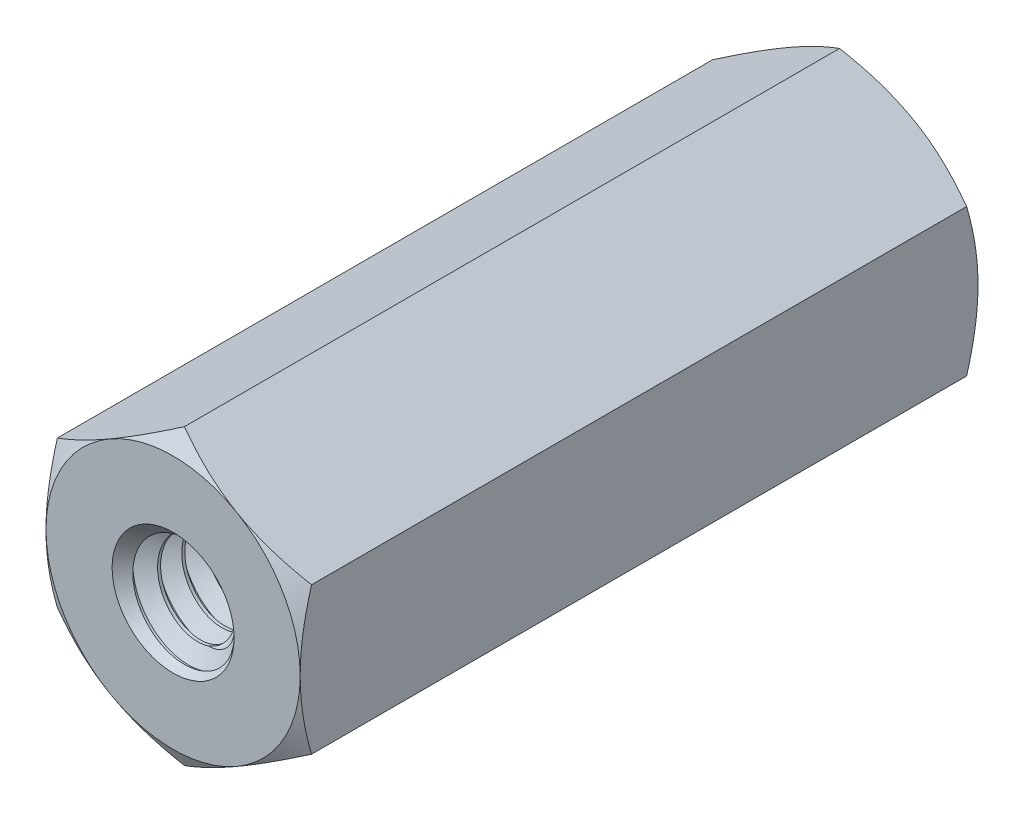
from build123d import *

# Parameters (mm, degrees)
EXTRUDE1_DEPTH          = 6.35
EXTRUDE1_DEPTH_BACK     = 6.35
SKETCH1_R               = 1.0922
SWEEP1_PITCH            = 0.453571429
EXTRUDE2_DEPTH          = 14.647410811
SKETCH8_OUTSIDE_W       = 60.508
SKETCH8_OUTSIDE_H       = 61.246
SKETCH8_OUTSIDE_R       = 2.38125
EXTRUDE4_DEPTH          = 14.647410811
EXTRUDE4_DRAFT          = -60
MIRROR1_COPY_1_SKETCH_W = 60.508
MIRROR1_COPY_1_SKETCH_H = 61.246
MIRROR1_COPY_1_SKETCH_R = 2.38125
MIRROR1_COPY_1_DEPTH    = 14.647410811
MIRROR1_COPY_1_DRAFT    = -60


with BuildPart() as part:
    # Sketch1 → Extrude1 (new, two sides: drawn at the far end of the back side and taken through both)
    with BuildSketch(Plane.XY.offset(-EXTRUDE1_DEPTH_BACK)):
        Polygon((0, 2.749630657), (-2.38125, 1.374815329), (-2.38125, -1.374815329), (0, -2.749630657), (2.38125, -1.374815329), (2.38125, 1.374815329), align=None)
        Circle(SKETCH1_R, mode=Mode.SUBTRACT)
    extrude(amount=EXTRUDE1_DEPTH + EXTRUDE1_DEPTH_BACK)

    # Sweep1: arcs per turn and ends read off the stored shape
    # Sweep1: the profile of Sketch12 profile screwed along a right-hand helix through 29 turns, 6 arcs to a turn; built about Z, then put on its axis
    sweep1_z = Axis((0, 0, 0), (0, 0, 1))
    sweep1_corners = [(1.0925, 0, -0.397048205), (1.0925, 0, 0.000173205), (0.797596715, 0, -0.170089286), (0.797596715, 0, -0.226785714)]
    with BuildLine(mode=Mode.PRIVATE) as sweep1_profile:
        Line(sweep1_corners[0], sweep1_corners[1])
        Line(sweep1_corners[1], sweep1_corners[2])
        Line(sweep1_corners[2], sweep1_corners[3])
        Line(sweep1_corners[3], sweep1_corners[0])
    sweep1_cap = Face(sweep1_profile.wire())
    sweep1_turn_angles = [0, 30, 60, 90, 120, 150, 180, 210, 240, 270, 300, 330, 360]
    sweep1_turn_weights = [1, 0.8660254037844387, 1, 0.8660254037844387, 1, 0.8660254037844387, 1, 0.8660254037844387, 1, 0.8660254037844387, 1, 0.8660254037844387, 1]
    sweep1_turn_rails = [Edge.make_bspline([Vector(p[0], p[1], 0).rotate(sweep1_z, sweep1_turn_angles[k]) / sweep1_turn_weights[k] + Vector(0, 0, p[2] + SWEEP1_PITCH * sweep1_turn_angles[k] / 360) for k in range(13)], [0, 0, 0, 1, 1, 2, 2, 3, 3, 4, 4, 5, 5, 6, 6, 6], 2, sweep1_turn_weights) for p in sweep1_corners]
    sweep1_turn_sides = [Face.make_surface_from_curves(sweep1_turn_rails[p[0]], sweep1_turn_rails[p[1]]) for p in [(0, 1), (1, 2), (2, 3), (3, 0)]]
    sweep1 = Plane(origin=(0, 0, -6.35), x_dir=(0, 1, 0), z_dir=(0, 0, 1)) * Solid(Shell([*[p.moved(Location((0, 0, SWEEP1_PITCH * i))) for i in range(29) for p in sweep1_turn_sides], sweep1_cap, sweep1_cap.rotate(sweep1_z, 10440).moved(Location((0, 0, SWEEP1_PITCH * 10440 / 360)))]))
    add(sweep1)

    # Sketch6 → Extrude2 (cut, through all)
    with BuildSketch(Plane(origin=(0, 0, -6.35), x_dir=(-1, 0, 0), z_dir=(0, 0, -1))):
        Polygon((0, 2.749630657), (-2.38125, 1.374815329), (-2.38125, -1.374815329), (0, -2.749630657), (2.38125, -1.374815329), (2.38125, 1.374815329), align=None)
    extrude2 = extrude(amount=EXTRUDE2_DEPTH, mode=Mode.SUBTRACT)

    # Extrude3 cone 1 section (through the dimple's axis) → Extrude3 (revolve, cut)
    with BuildSketch(Plane(origin=(0, 0, -6.35), x_dir=(0, 1, 0), z_dir=(1, 0, 0))):
        Polygon((0, 0), (1.143, 0), (0, 1.225717436), align=None)
    extrude3 = revolve(axis=Axis((0, 0, -6.35), (0, 0, 1)), mode=Mode.SUBTRACT)


with BuildPart() as extrude4_tool:
    # Sketch8 outside → Extrude4 (with draft: the straight prism first)
    with BuildSketch(Plane(origin=(0, 0, -6.35), x_dir=(-1, 0, 0), z_dir=(0, 0, -1))):
        Rectangle(SKETCH8_OUTSIDE_W, SKETCH8_OUTSIDE_H)
        Circle(SKETCH8_OUTSIDE_R, mode=Mode.SUBTRACT)
    extrude(amount=-EXTRUDE4_DEPTH)
    # Extrude4: the draft: its side faces are tilted about the plane it starts from
    extrude4_sides = [extrude4_tool.faces().sort_by_distance(p)[0] for p in [
        (0, -30.623, 0.973705406),
        (-30.254, 0, 0.973705406),
        (0, 30.623, 0.973705406),
        (30.254, 0, 0.973705406),
        (2.38125, 0, 0.973705406),
    ]]
    draft(extrude4_sides, Plane(origin=(0, 0, -6.35), x_dir=(-1, 0, 0), z_dir=(0, 0, -1)), EXTRUDE4_DRAFT)


with BuildPart() as part_1:
    add(part.part)

    # Extrude4: cut by extrude4_tool
    add(extrude4_tool.part, mode=Mode.SUBTRACT)

    # Mirror1: Extrude2, Extrude3 across plane
    add(extrude2.mirror(Plane.XY), mode=Mode.SUBTRACT)
    add(extrude3.mirror(Plane.XY), mode=Mode.SUBTRACT)


with BuildPart() as mirror1_copy_1_tool:
    # Mirror1 copy 1 sketch → Mirror1 copy 1 (with draft: the straight prism first)
    with BuildSketch(Plane(origin=(0, 0, 6.35), x_dir=(-1, 0, 0), z_dir=(0, 0, 1))):
        Rectangle(MIRROR1_COPY_1_SKETCH_W, MIRROR1_COPY_1_SKETCH_H)
        Circle(MIRROR1_COPY_1_SKETCH_R, mode=Mode.SUBTRACT)
    extrude(amount=-MIRROR1_COPY_1_DEPTH)
    # Mirror1 copy 1: the draft: its side faces are tilted about the plane it starts from
    mirror1_copy_1_sides = [mirror1_copy_1_tool.faces().sort_by_distance(p)[0] for p in [
        (0, -30.623, -0.973705406),
        (-30.254, 0, -0.973705406),
        (0, 30.623, -0.973705406),
        (30.254, 0, -0.973705406),
        (2.38125, 0, -0.973705406),
    ]]
    draft(mirror1_copy_1_sides, Plane(origin=(0, 0, 6.35), x_dir=(-1, 0, 0), z_dir=(0, 0, 1)), MIRROR1_COPY_1_DRAFT)


with BuildPart() as part_2:
    add(part_1.part)

    # Mirror1 copy 1: cut by mirror1_copy_1_tool
    add(mirror1_copy_1_tool.part, mode=Mode.SUBTRACT)


solid = part_2.part
